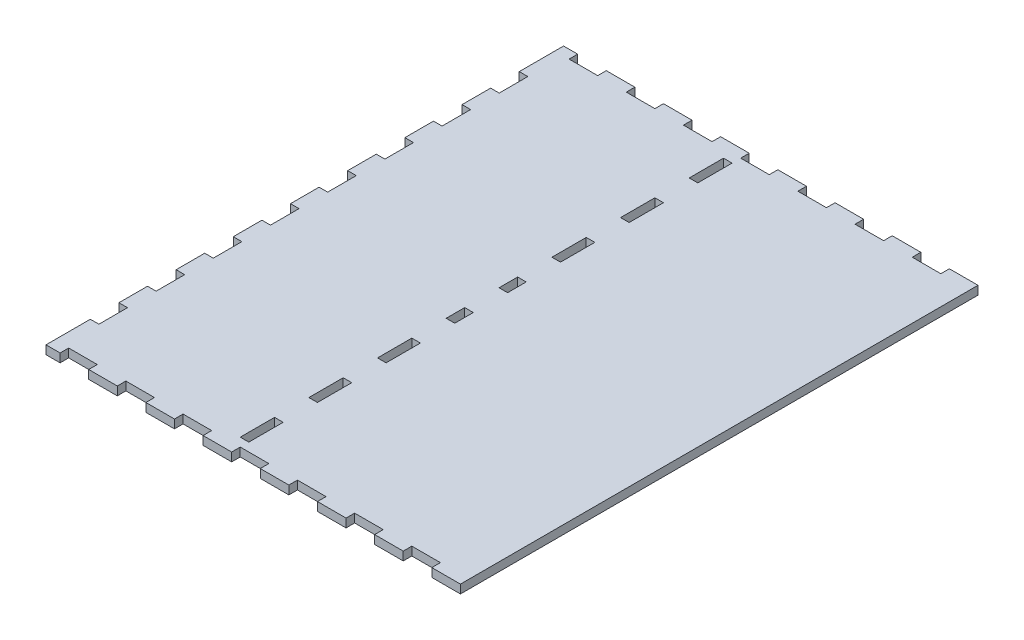
from build123d import *

# Parameters (mm, degrees)
BOSS_EXTRUDE1_DEPTH = 3
SKETCH2_W           = 3
SKETCH2_H           = 12
SKETCH2_H_2         = 6.5
CUT_EXTRUDE1_DEPTH  = 10


with BuildPart() as part:
    # Sketch1 → Boss-Extrude1 (new body)
    with BuildSketch(Plane(origin=(0, 0, 0), x_dir=(1, 0, 0), z_dir=(0, 1, 0))):
        Polygon((0, 0), (0, 15.5), (3, 15.5), (3, 25.5), (0, 25.5), (0, 35.5), (3, 35.5), (3, 45.5), (0, 45.5), (0, 55.5), (3, 55.5), (3, 65.5), (0, 65.5), (0, 75.5), (3, 75.5), (3, 85.5), (0, 85.5), (0, 95.5), (3, 95.5), (3, 105.5), (0, 105.5), (0, 115.5), (3, 115.5), (3, 125.5), (0, 125.5), (0, 135.5), (3, 135.5), (3, 145.5), (0, 145.5), (0, 155.5), (3, 155.5), (3, 165.5), (0, 165.5), (0, 181), (4.93, 181), (4.93, 178), (14.93, 178), (14.93, 181), (24.93, 181), (24.93, 178), (34.93, 178), (34.93, 181), (44.93, 181), (44.93, 178), (54.93, 178), (54.93, 181), (64.93, 181), (64.93, 178), (74.93, 178), (74.93, 181), (84.93, 181), (84.93, 178), (94.93, 178), (94.93, 181), (104.93, 181), (104.93, 178), (114.93, 178), (114.93, 181), (124.93, 181), (124.93, 178), (134.93, 178), (134.93, 181), (144.93, 181), (144.93, 0), (134.93, 0), (134.93, 3), (124.93, 3), (124.93, 0), (114.93, 0), (114.93, 3), (104.93, 3), (104.93, 0), (94.93, 0), (94.93, 3), (84.93, 3), (84.93, 0), (74.93, 0), (74.93, 3), (64.93, 3), (64.93, 0), (54.93, 0), (54.93, 3), (44.93, 3), (44.93, 0), (34.93, 0), (34.93, 3), (24.93, 3), (24.93, 0), (14.93, 0), (14.93, 3), (4.93, 3), (4.93, 0), align=None)
    extrude(amount=BOSS_EXTRUDE1_DEPTH)

    # Sketch2 → Cut-Extrude1 (cut)
    with BuildSketch(Plane.XZ):
        with Locations((63.43, -36)):
            Rectangle(SKETCH2_W, SKETCH2_H)
        with Locations((63.43, -12)):
            Rectangle(SKETCH2_W, SKETCH2_H)
        with Locations((63.43, -169)):
            Rectangle(SKETCH2_W, SKETCH2_H)
        with Locations((63.43, -145)):
            Rectangle(SKETCH2_W, SKETCH2_H)
        with Locations((63.43, -121)):
            Rectangle(SKETCH2_W, SKETCH2_H)
        with Locations((63.43, -99.75)):
            Rectangle(SKETCH2_W, SKETCH2_H_2)
        with Locations((63.43, -81.25)):
            Rectangle(SKETCH2_W, SKETCH2_H_2)
        with Locations((63.43, -60)):
            Rectangle(SKETCH2_W, SKETCH2_H)
    extrude(amount=-CUT_EXTRUDE1_DEPTH, mode=Mode.SUBTRACT)


solid = part.part
